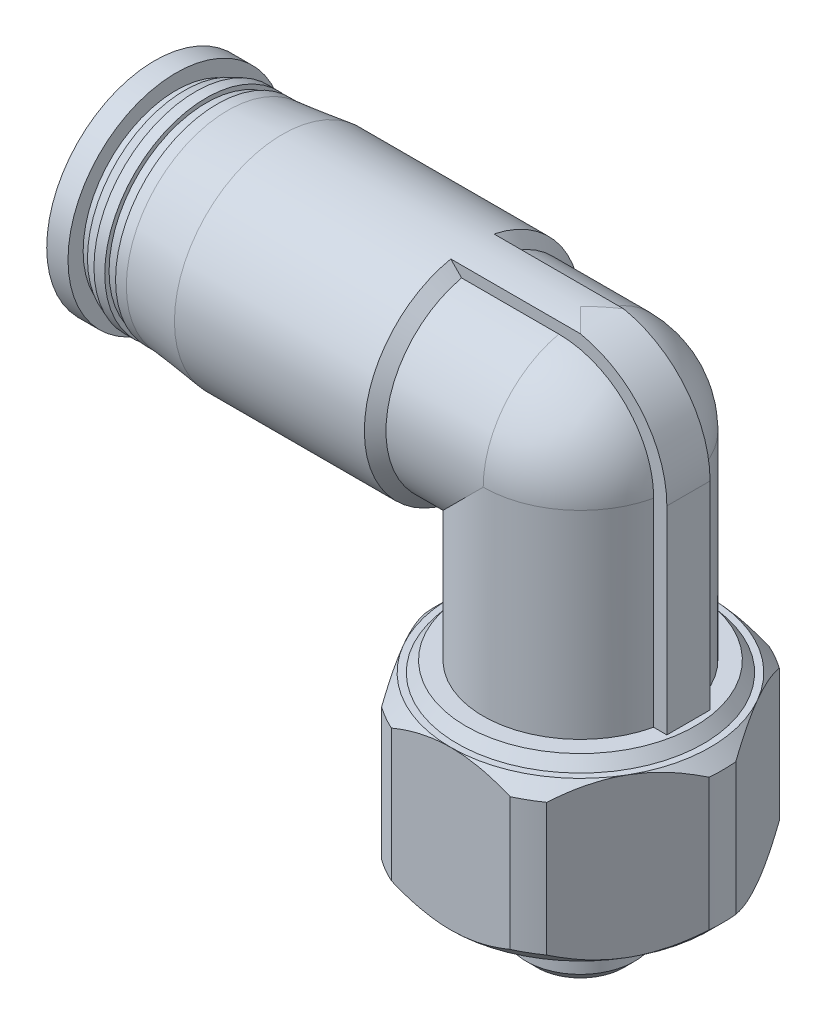
from build123d import *
from build123d.topology import SkipClean

# Parameters (mm, degrees)
SKETCH3_W                    = 24
SKETCH3_H                    = 24
CUT_EXTRUDE1_DEPTH           = 8.2
BOSS_EXTRUDE1_DEPTH          = 1
BOSS_EXTRUDE1_DEPTH_BACK     = 1
SKETCH6_R                    = 2
CUT_EXTRUDE2_DEPTH           = 19.7
SKETCH8_W                    = 10
SKETCH8_H                    = 2
CUT_REVOLVE2_ANGLE           = 30
CUT_REVOLVE2_OTHER_WAY_ANGLE = 30


with BuildPart() as part:
    # Sketch1 → Revolve1 (revolve)
    with BuildSketch(Plane.XY):
        Polygon((0, 0), (-6, 0), (-6.6, 0.6), (-6.6, 6.721428571), (-6, 7.321428571), (-5.7, 7.321428571), (-5.3, 7.821428571), (-4.5, 7.821428571), (-4.5, 17), (0, 17), align=None)
    revolve(axis=Axis((0, 17, 0), (0, -1, 0)))

    # Sketch2 → Revolve2 (revolve)
    with BuildSketch(Plane.XY):
        Polygon((0, -3.5), (-2.0095, -3.5), (-2.5, -3.0095), (-2.5, -0.5), (-3.6, -0.5), (-3.6, 0), (0, 0), align=None)
    revolve(axis=Axis((0, 0, 0), (0, -1, 0)))

    # Sketch3 → Cut-Extrude1 (cut)
    with BuildSketch(Plane(origin=(0, 0, 0), x_dir=(1, 0, 0), z_dir=(0, 1, 0))):
        Rectangle(SKETCH3_W, SKETCH3_H)
        Polygon((-6.92820323, 0), (-3.464101615, -6), (3.464101615, -6), (6.92820323, 0), (3.464101615, 6), (-3.464101615, 6), align=None, mode=Mode.SUBTRACT)
    extrude(amount=CUT_EXTRUDE1_DEPTH, mode=Mode.SUBTRACT)

    # Sketch4 → Revolve3 (revolve)
    with BuildSketch(Plane.XY):
        with BuildLine():
            Line((-19.7, 17), (-19.7, 22))
            Line((-19.7, 22), (-18.715, 22))
            Line((-18.715, 22), (-18.715, 21.3))
            Line((-18.715, 21.3), (-18.315, 21.3))
            Line((-18.315, 21.3), (-18.315, 21.5))
            Line((-18.315, 21.5), (-17.815, 21.7))
            Line((-17.815, 21.7), (-17.315, 21.7))
            Line((-17.315, 21.7), (-17.315, 21.5))
            Line((-17.315, 21.5), (-16.815, 21.5))
            Line((-16.815, 21.5), (-16.815, 21.7))
            Line((-16.815, 21.7), (-16.315, 21.7))
            Line((-16.315, 21.7), (-13.79, 22))
            Line((-13.79, 22), (-5, 22))
            Line((-5, 22), (-4.5, 21.5))
            Line((-4.5, 21.5), (0, 21.5))
            ThreePointArc((0, 21.5), (3.181980515, 20.181980515), (4.5, 17))
            Line((4.5, 17), (-19.7, 17))
        make_face()
    revolve(axis=Axis((4.5, 17, 0), (-1, 0, 0)))

    # Sketch5 → Boss-Extrude1 (add, two sides: drawn at the far end of the back side and taken through both)
    with BuildSketch(Plane.XY.offset(-BOSS_EXTRUDE1_DEPTH_BACK)):
        with BuildLine():
            Line((-5, 17), (0, 17))
            Line((0, 17), (0, 5.7))
            Line((0, 5.7), (5, 5.7))
            Line((5, 5.7), (5, 17))
            ThreePointArc((5, 17), (3.535533906, 20.535533906), (0, 22))
            Line((0, 22), (-5, 22))
            Line((-5, 22), (-5, 17))
        make_face()
    extrude(amount=BOSS_EXTRUDE1_DEPTH + BOSS_EXTRUDE1_DEPTH_BACK)

    # Sketch6 → Cut-Extrude2 (cut)
    with BuildSketch(Plane(origin=(0, 0, 0), x_dir=(0, 0, -1), z_dir=(1, 0, 0))):
        with Locations((0, 17)):
            Circle(SKETCH6_R)
    extrude(amount=-CUT_EXTRUDE2_DEPTH, mode=Mode.SUBTRACT)

    # Sketch7 → Cut-Revolve1 (revolve, cut)
    with BuildSketch(Plane.XY):
        with BuildLine():
            Line((0, -3.5), (-1.25, -3.5))
            Line((-1.25, -3.5), (-1.25, 1))
            Line((-1.25, 1), (-2, 1))
            Line((-2, 1), (-2, 17))
            ThreePointArc((-2, 17), (-1.414213562, 18.414213562), (0, 19))
            Line((0, 19), (0, -3.5))
        make_face()
    revolve(axis=Axis((0, 19, 0), (0, -1, 0)), mode=Mode.SUBTRACT)

    # Sketch8 → Cut-Revolve2 (revolve, cut)
    with BuildSketch(Plane.XY):
        with Locations((-2, 23)):
            Rectangle(SKETCH8_W, SKETCH8_H)
    revolve(axis=Axis((3, 17, 0), (1, 0, 0)), revolution_arc=CUT_REVOLVE2_ANGLE, mode=Mode.SUBTRACT)

    # Sketch8 → Cut-Revolve2 other way (revolve, cut)
    with SkipClean():  # the faces are left unmerged after this step: merging them gives an invalid solid
        with BuildSketch(Plane.XY):
            with Locations((-2, 23)):
                Rectangle(SKETCH8_W, SKETCH8_H)
        revolve(axis=Axis((3, 17, 0), (-1, 0, 0)), revolution_arc=CUT_REVOLVE2_OTHER_WAY_ANGLE, mode=Mode.SUBTRACT)


solid = part.part
